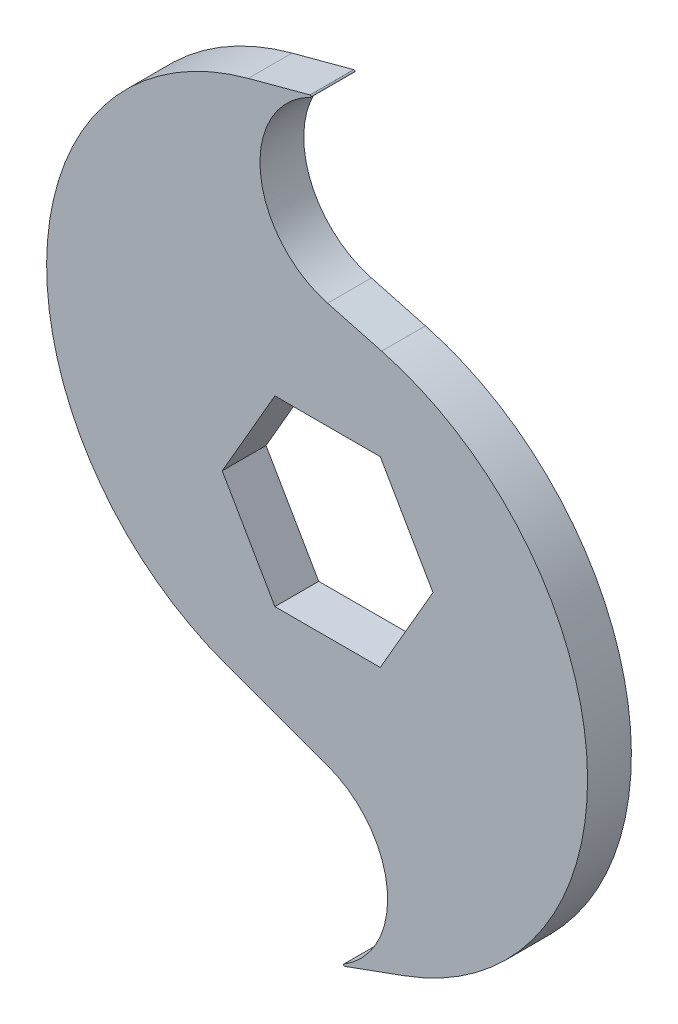
from build123d import *

# Parameters (mm, degrees)
BOSS_EXTRUDE1_DEPTH = 3.048
FILLET1_R           = 0.127


with BuildPart() as part:
    # Sketch1 → Boss-Extrude1 (new, symmetric)
    with BuildSketch(Plane.XY):
        with BuildLine():
            Line((0, 52.07), (-11.040532194, 49.111698314))
            ThreePointArc((-11.040532194, 49.111698314), (-39.066320922, 14.192289272), (-14.190605813, -23.03684931))
            Line((-14.190605813, -23.03684931), (0, -28.201807432))
            ThreePointArc((0, -28.201807432), (8.35634418, -40.135903716), (0, -52.07))
            Line((0, -52.07), (10.740686656, -48.160709762))
            ThreePointArc((10.740686656, -48.160709762), (36.144496882, -10.141220984), (7.52373904, 25.519504212))
            Line((7.52373904, 25.519504212), (0, 27.535484012))
            ThreePointArc((0, 27.535484012), (-9.412998127, 39.802742006), (0, 52.07))
        make_face()
        Polygon((-7.332348419, 12.7), (-14.664696837, 0), (-7.332348419, -12.7), (7.332348419, -12.7), (14.664696837, 0), (7.332348419, 12.7), align=None, mode=Mode.SUBTRACT)
    extrude(amount=BOSS_EXTRUDE1_DEPTH, both=True)

    # Fillet1
    fillet1_edges = [part.edges().sort_by_distance(p)[0] for p in [
        (0, 52.07, 0),
        (0, -52.07, 0),
    ]]
    fillet(fillet1_edges, radius=FILLET1_R)


solid = part.part
